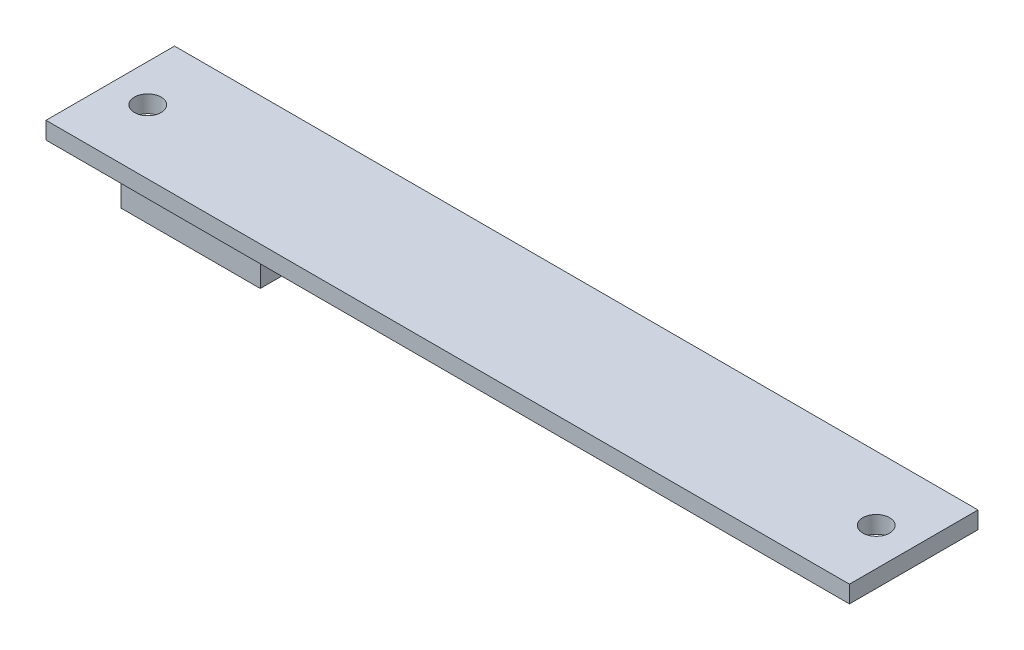
from build123d import *

# Parameters (mm, degrees)
SKETCH1_W           = 75
SKETCH1_H           = 12
PCB_DEPTH           = 1.6
SKETCH2_R           = 1.25
SCREW_HOLES_DEPTH   = 76.970783858
SKETCH3_W           = 13
SKETCH3_H           = 2.3
BOSS_EXTRUDE1_DEPTH = 3


with BuildPart() as part:
    # Sketch1 → pcb (new body)
    with BuildSketch(Plane(origin=(0, 0, 0), x_dir=(1, 0, 0), z_dir=(0, 1, 0))):
        with Locations((-37.5, 6)):
            Rectangle(SKETCH1_W, SKETCH1_H)
    extrude(amount=PCB_DEPTH)

    # Sketch2 → screw holes (cut, through all)
    with BuildSketch(Plane(origin=(0, 1.6, 0), x_dir=(1, 0, 0), z_dir=(0, 1, 0))):
        with Locations((-71.5, 6)):
            Circle(SKETCH2_R)
        with Locations((-3.5, 6)):
            Circle(SKETCH2_R)
    extrude(amount=-SCREW_HOLES_DEPTH, mode=Mode.SUBTRACT)

    # Sketch3 → Boss-Extrude1 (add)
    with BuildSketch(Plane.XZ):
        with Locations((-62.5, -2.15)):
            Rectangle(SKETCH3_W, SKETCH3_H)
    extrude(amount=BOSS_EXTRUDE1_DEPTH)


solid = part.part
